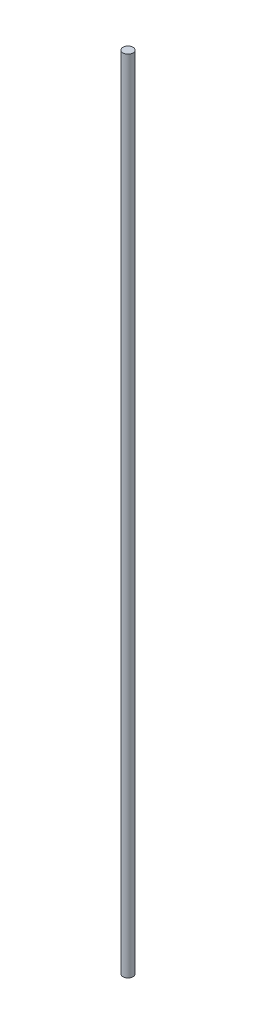
from build123d import *

# Parameters (mm, degrees)
SKETCH1_R           = 3.175
BOSS_EXTRUDE1_DEPTH = 254


with BuildPart() as part:
    # Sketch1 → Boss-Extrude1 (new, symmetric)
    with BuildSketch(Plane(origin=(0, 0, 0), x_dir=(1, 0, 0), z_dir=(0, 1, 0))):
        Circle(SKETCH1_R)
    extrude(amount=BOSS_EXTRUDE1_DEPTH, both=True)


solid = part.part
